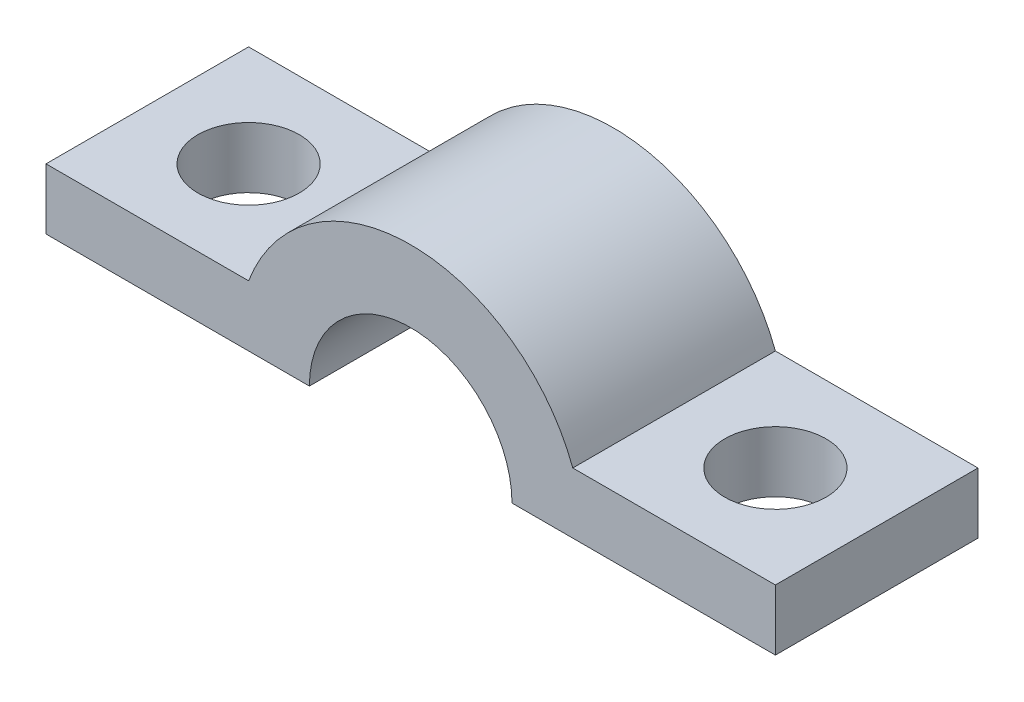
from build123d import *

# Parameters (mm, degrees)
BOSS_EXTRUDE1_DEPTH = 12.7
SKETCH2_R           = 3.175
CUT_EXTRUDE1_DEPTH  = 33.620364163


with BuildPart() as part:
    # Sketch1 → Boss-Extrude1 (new body)
    with BuildSketch(Plane.XY):
        with BuildLine():
            Line((-3.81, 3.81), (-16.51, 3.81))
            Line((-16.51, 3.81), (-16.51, 0))
            Line((-16.51, 0), (0, 0))
            ThreePointArc((0, 0), (6.35, 6.35), (12.7, 0))
            Line((12.7, 0), (29.21, 0))
            Line((29.21, 0), (29.21, 3.81))
            Line((29.21, 3.81), (16.51, 3.81))
            ThreePointArc((16.51, 3.81), (6.35, 10.850884757), (-3.81, 3.81))
        make_face()
    extrude(amount=BOSS_EXTRUDE1_DEPTH)

    # Sketch2 → Cut-Extrude1 (cut, through all)
    with BuildSketch(Plane(origin=(0, 3.81, 0), x_dir=(1, 0, 0), z_dir=(0, 1, 0))):
        with Locations((-10.16, -6.35)):
            Circle(SKETCH2_R)
        with Locations((22.86, -6.35)):
            Circle(SKETCH2_R)
    extrude(amount=-CUT_EXTRUDE1_DEPTH, mode=Mode.SUBTRACT)


solid = part.part
